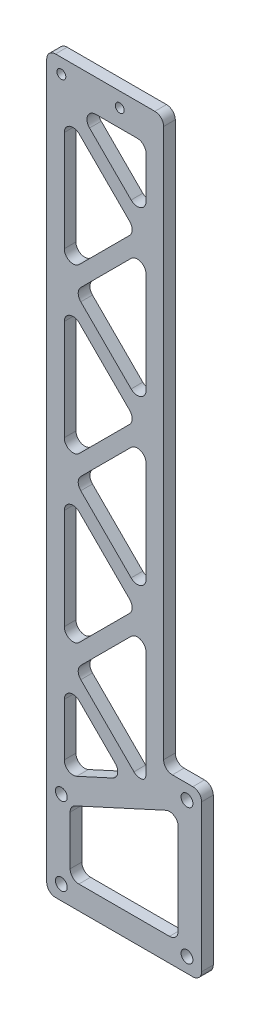
from build123d import *

# Parameters (mm, degrees)
SKETCH_1_W          = 53
SKETCH_1_H          = 250
SKETCH_1_R          = 2.025
EXTRUDE_1_DEPTH     = 4
SKETCH_2_W          = 13
SKETCH_2_H          = 193.6536947
CUT_EXTRUDE_1_DEPTH = 4
SKETCH_6_R          = 1.525
CUT_EXTRUDE_3_DEPTH = 4
FILLET_1_R          = 3
CUT_EXTRUDE_4_DEPTH = 4
FILLET_2_R          = 3
CUT_EXTRUDE_5_DEPTH = 4
FILLET_3_R          = 3
FILLET_4_R          = 3


with BuildPart() as part:
    # 草图1 → 凸台-拉伸1 (new body)
    with BuildSketch(Plane.XY):
        with Locations((0, 96.82684735)):
            Rectangle(SKETCH_1_W, SKETCH_1_H)
        with Locations((21.5, 23.17315265)):
            Circle(SKETCH_1_R, mode=Mode.SUBTRACT)
        with Locations((21.5, -23.17315265)):
            Circle(SKETCH_1_R, mode=Mode.SUBTRACT)
        with Locations((-21.5, -23.17315265)):
            Circle(SKETCH_1_R, mode=Mode.SUBTRACT)
        with Locations((-21.5, 3.47684735)):
            Circle(SKETCH_1_R, mode=Mode.SUBTRACT)
    extrude(amount=EXTRUDE_1_DEPTH)

    # 草图2 → 切除-拉伸1 (cut)
    with BuildSketch(Plane.XY.offset(4)):
        with Locations((20, 125)):
            Rectangle(SKETCH_2_W, SKETCH_2_H)
    extrude(amount=-CUT_EXTRUDE_1_DEPTH, mode=Mode.SUBTRACT)

    # 草图6 → 切除-拉伸3 (cut)
    with BuildSketch(Plane(origin=(0, 0, 0), x_dir=(-1, 0, 0), z_dir=(0, 0, -1))):
        with Locations((21.5, 216.82684735)):
            Circle(SKETCH_6_R)
        with Locations((1.5, 216.82684735)):
            Circle(SKETCH_6_R)
    extrude(amount=-CUT_EXTRUDE_3_DEPTH, mode=Mode.SUBTRACT)

    # 圆角1
    fillet_1_edges = [part.edges().sort_by_distance(p)[0] for p in [
        (13.5, 221.82684735, 2),
        (26.5, 28.17315265, 2),
        (13.5, 28.17315265, 2),
        (-26.5, 221.82684735, 2),
        (26.5, -28.17315265, 2),
        (-26.5, -28.17315265, 2),
    ]]
    fillet(fillet_1_edges, radius=FILLET_1_R)

    # 草图7 → 切除-拉伸4 (cut)
    with BuildSketch(Plane.XY.offset(4)):
        Polygon((18.5, 18.499246673), (-18.5, 1.551263043), (-18.5, -20.17315265), (18.5, -20.17315265), align=None)
    extrude(amount=-CUT_EXTRUDE_4_DEPTH, mode=Mode.SUBTRACT)

    # 圆角2
    fillet_2_edges = [part.edges().sort_by_distance(p)[0] for p in [
        (18.5, 18.499246673, 2),
        (18.5, -20.17315265, 2),
        (-18.5, -20.17315265, 2),
        (-18.5, 1.551263043, 2),
    ]]
    fillet(fillet_2_edges, radius=FILLET_2_R)

    # 草图8 → 切除-拉伸5 (cut)
    with BuildSketch(Plane(origin=(0, 0, 0), x_dir=(-1, 0, 0), z_dir=(0, 0, -1))):
        Polygon((20.5, 39.291313444), (0.022812462, 18.814125906), (20.5, 9.434476198), align=None)
        Polygon((16.964466094, 42.82684735), (-7.5, 67.291313444), (-7.5, 22.259977323), (-4.826849962, 21.035531294), align=None)
        Polygon((20.5, 46.362381256), (20.5, 95.291313444), (-3.964466094, 70.82684735), align=None)
        Polygon((16.964466094, 98.82684735), (-7.5, 123.291313444), (-7.5, 74.362381256), align=None)
        Polygon((20.5, 102.362381256), (20.5, 151.291313444), (-3.964466094, 126.82684735), align=None)
        Polygon((16.964466094, 154.82684735), (-7.5, 179.291313444), (-7.5, 130.362381256), align=None)
        Polygon((20.5, 158.362381256), (20.5, 207.291313444), (-3.964466094, 182.82684735), align=None)
        Polygon((16.964466094, 210.82684735), (-7.5, 210.82684735), (-7.5, 186.362381256), align=None)
    extrude(amount=-CUT_EXTRUDE_5_DEPTH, mode=Mode.SUBTRACT)

    # 圆角3
    fillet_3_edges = [part.edges().sort_by_distance(p)[0] for p in [
        (4.826849962, 21.035531294, 2),
    ]]
    fillet(fillet_3_edges, radius=FILLET_3_R)

    # 圆角4
    # the kernel refuses this fillet: 3 mm, written as the material it adds along each edge
    with BuildSketch(Plane(origin=(-16.964466094, 98.82684735, 0), x_dir=(0.707106781186547, 0.7071067811865482, 0), z_dir=(0, 0, 1)), Plane(origin=(3.964466094, 126.82684735, 0), x_dir=(-0.7071067811865479, -0.707106781186547, 0), z_dir=(0, 0, 1)), Plane(origin=(7.5, 210.82684735, 0), x_dir=(0, -1, 0), z_dir=(0, 0, 1)), Plane(origin=(-16.964466094, 154.82684735, 0), x_dir=(0.7071067811865442, 0.7071067811865508, 0), z_dir=(0, 0, 1)), Plane(origin=(3.964466094, 182.82684735, 0), x_dir=(-0.7071067811865441, -0.7071067811865508, 0), z_dir=(0, 0, 1))) as fillet_4_piece_1:
        with BuildLine():
            CenterArc((FILLET_4_R, -FILLET_4_R), FILLET_4_R, 90, 90)
            Line((0, -FILLET_4_R), (-FILLET_4_R * 0.02, -FILLET_4_R))
            Line((-FILLET_4_R * 0.02, -FILLET_4_R), (-FILLET_4_R * 0.02, FILLET_4_R * 0.02))
            Line((-FILLET_4_R * 0.02, FILLET_4_R * 0.02), (FILLET_4_R, FILLET_4_R * 0.02))
            Line((FILLET_4_R, FILLET_4_R * 0.02), (FILLET_4_R, 0))
        make_face()
    extrude(amount=4)
    with BuildSketch(Plane(origin=(7.5, 74.362381256, 0), x_dir=(0, 1, 0), z_dir=(0, 0, 1)), Plane(origin=(-20.5, 102.362381256, 0), x_dir=(0.7071067811865476, 0.7071067811865476, 0), z_dir=(0, 0, 1)), Plane(origin=(7.5, 67.291313444, 0), x_dir=(-0.7071067811865478, -0.7071067811865471, 0), z_dir=(0, 0, 1)), Plane(origin=(-16.964466094, 210.82684735, 0), x_dir=(0.7071067811865466, -0.7071067811865486, 0), z_dir=(0, 0, 1)), Plane(origin=(7.5, 130.362381256, 0), x_dir=(0, 1, 0), z_dir=(0, 0, 1)), Plane(origin=(-20.5, 158.362381256, 0), x_dir=(0.707106781186543, 0.707106781186552, 0), z_dir=(0, 0, 1)), Plane(origin=(-20.5, 39.291313444, 0), x_dir=(0, -1, 0), z_dir=(0, 0, 1))) as fillet_4_piece_2:
        with BuildLine():
            CenterArc((FILLET_4_R * 2.41421356237, FILLET_4_R), FILLET_4_R, 135, 135)
            Line((FILLET_4_R * 1.70710678119, FILLET_4_R * 1.70710678119), (FILLET_4_R * 1.69296464556, FILLET_4_R * 1.72124891681))
            Line((FILLET_4_R * 1.69296464556, FILLET_4_R * 1.72124891681), (-FILLET_4_R * 0.0141421356237, FILLET_4_R * 0.0141421356237))
            Line((-FILLET_4_R * 0.0141421356237, FILLET_4_R * 0.0141421356237), (0, -FILLET_4_R * 0.02))
            Line((0, -FILLET_4_R * 0.02), (FILLET_4_R * 2.41421356237, -FILLET_4_R * 0.02))
            Line((FILLET_4_R * 2.41421356237, -FILLET_4_R * 0.02), (FILLET_4_R * 2.41421356237, 0))
        make_face()
    extrude(amount=4)
    with BuildSketch(Plane(origin=(7.5, 123.291313444, 0), x_dir=(0, -1, 0), z_dir=(0, 0, 1)), Plane(origin=(-20.5, 151.291313444, 0), x_dir=(0.707106781186547, -0.707106781186548, 0), z_dir=(0, 0, 1)), Plane(origin=(-20.5, 46.362381256, 0), x_dir=(0, 1, 0), z_dir=(0, 0, 1)), Plane(origin=(-20.5, 95.291313444, 0), x_dir=(0.7071067811865476, -0.7071067811865476, 0), z_dir=(0, 0, 1)), Plane(origin=(7.5, 186.362381256, 0), x_dir=(-0.7071067811865478, 0.7071067811865474, 0), z_dir=(0, 0, 1)), Plane(origin=(7.5, 179.291313444, 0), x_dir=(0, -1, 0), z_dir=(0, 0, 1)), Plane(origin=(-20.5, 207.291313444, 0), x_dir=(0.7071067811865468, -0.7071067811865482, 0), z_dir=(0, 0, 1))) as fillet_4_piece_3:
        with BuildLine():
            CenterArc((FILLET_4_R * 2.41421356237, -FILLET_4_R), FILLET_4_R, 90, 135)
            Line((FILLET_4_R * 1.70710678119, -FILLET_4_R * 1.70710678119), (FILLET_4_R * 1.69296464556, -FILLET_4_R * 1.72124891681))
            Line((FILLET_4_R * 1.69296464556, -FILLET_4_R * 1.72124891681), (-FILLET_4_R * 0.0141421356237, -FILLET_4_R * 0.0141421356237))
            Line((-FILLET_4_R * 0.0141421356237, -FILLET_4_R * 0.0141421356237), (0, FILLET_4_R * 0.02))
            Line((0, FILLET_4_R * 0.02), (FILLET_4_R * 2.41421356237, FILLET_4_R * 0.02))
            Line((FILLET_4_R * 2.41421356237, FILLET_4_R * 0.02), (FILLET_4_R * 2.41421356237, 0))
        make_face()
    extrude(amount=4)
    with BuildSketch(Plane(origin=(-16.964466094, 42.82684735, 0), x_dir=(0.7071067811865487, -0.7071067811865464, 0), z_dir=(0, 0, 1)), Plane(origin=(3.964466094, 70.82684735, 0), x_dir=(-0.707106781186549, 0.707106781186546, 0), z_dir=(0, 0, 1))) as fillet_4_piece_4:
        with BuildLine():
            CenterArc((FILLET_4_R, FILLET_4_R), FILLET_4_R, 180, 90)
            Line((0, FILLET_4_R), (-FILLET_4_R * 0.02, FILLET_4_R))
            Line((-FILLET_4_R * 0.02, FILLET_4_R), (-FILLET_4_R * 0.02, -FILLET_4_R * 0.02))
            Line((-FILLET_4_R * 0.02, -FILLET_4_R * 0.02), (FILLET_4_R, -FILLET_4_R * 0.02))
            Line((FILLET_4_R, -FILLET_4_R * 0.02), (FILLET_4_R, 0))
        make_face()
    extrude(amount=4)
    with BuildSketch(Plane(origin=(7.5, 22.259977323, 0), x_dir=(-0.9091611234166711, -0.4164445361242436, 0), z_dir=(0, 0, 1))) as fillet_4_piece_5:
        with BuildLine():
            CenterArc((2.03672897, -2.757354466), FILLET_4_R, 113.202499131, 42.187182076)
            Line((-0.6907544, -1.508020858), (-0.745304068, -1.483034186))
            Line((-0.745304068, -1.483034186), (-0.054549667, 0.024986672))
            Line((-0.054549667, 0.024986672), (0, 0.06))
            ThreePointArc((0, 0.06), (0.427391485, 0.06), (0.83114405, 0.055147089))
            Line((0.83114405, 0.055147089), (0.85478297, 0))
        make_face()
    extrude(amount=4)
    with BuildSketch(Plane(origin=(-0.022812462, 18.814125906, 0), x_dir=(-0.9091611234134724, -0.4164445361312268, 0), z_dir=(0, 0, 1))) as fillet_4_piece_6:
        with BuildLine():
            CenterArc((FILLET_4_R * 1.43853500921, -FILLET_4_R), FILLET_4_R, 90, 110.389681207)
            Line((FILLET_4_R * 0.501190258162, -FILLET_4_R * 1.34840324007), (FILLET_4_R * 0.482443363141, -FILLET_4_R * 1.35537130487))
            Line((FILLET_4_R * 0.482443363141, -FILLET_4_R * 1.35537130487), (-FILLET_4_R * 0.0287707001841, FILLET_4_R * 0.02))
            Line((-FILLET_4_R * 0.0287707001841, FILLET_4_R * 0.02), (FILLET_4_R * 1.43853500921, FILLET_4_R * 0.02))
            Line((FILLET_4_R * 1.43853500921, FILLET_4_R * 0.02), (FILLET_4_R * 1.43853500921, 0))
        make_face()
    extrude(amount=4)
    with BuildSketch(Plane(origin=(-20.5, 9.434476198, 0), x_dir=(0, 1, 0), z_dir=(0, 0, 1))) as fillet_4_piece_7:
        with BuildLine():
            CenterArc((FILLET_4_R * 1.55796865886, -FILLET_4_R), FILLET_4_R, 90, 114.610318793)
            Line((FILLET_4_R * 0.648807535446, -FILLET_4_R * 1.41644453613), (FILLET_4_R * 0.630624312977, -FILLET_4_R * 1.42477342685))
            Line((FILLET_4_R * 0.630624312977, -FILLET_4_R * 1.42477342685), (-FILLET_4_R * 0.0311593731772, FILLET_4_R * 0.02))
            Line((-FILLET_4_R * 0.0311593731772, FILLET_4_R * 0.02), (FILLET_4_R * 1.55796865886, FILLET_4_R * 0.02))
            Line((FILLET_4_R * 1.55796865886, FILLET_4_R * 0.02), (FILLET_4_R * 1.55796865886, 0))
        make_face()
    extrude(amount=4)


solid = part.part
